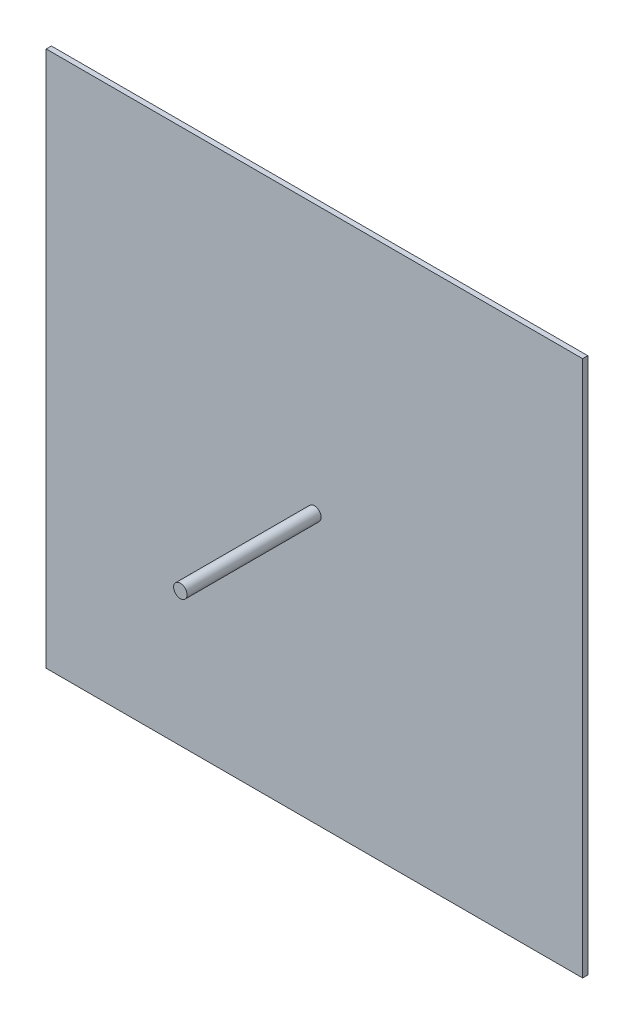
from build123d import *

# Parameters (mm, degrees)
SKETCH3_W           = 101.6
SKETCH3_H           = 101.6
BOSS_EXTRUDE2_DEPTH = 0.9779
SKETCH4_R           = 1.27
BOSS_EXTRUDE3_DEPTH = 25.4


with BuildPart() as part:
    # Sketch3 → Boss-Extrude2 (new body)
    with BuildSketch(Plane.XY):
        Rectangle(SKETCH3_W, SKETCH3_H)
    extrude(amount=BOSS_EXTRUDE2_DEPTH)

    # Sketch4 → Boss-Extrude3 (add)
    with BuildSketch(Plane.XY.offset(0.9779)):
        Circle(SKETCH4_R)
    extrude(amount=BOSS_EXTRUDE3_DEPTH)


solid = part.part
